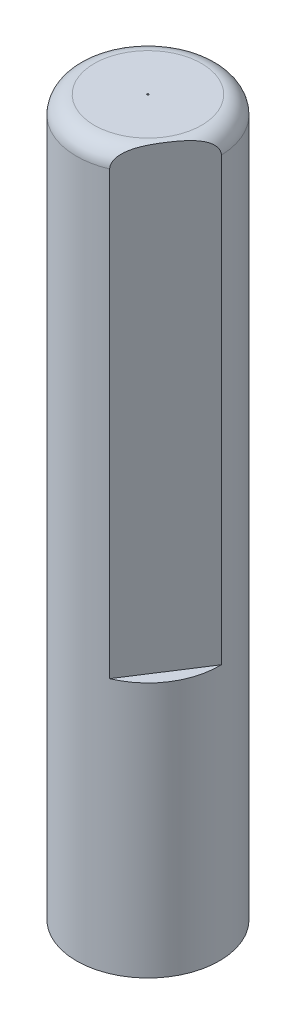
from build123d import *

# Parameters (mm, degrees)
SKETCH1_R           = 4
BOSS_EXTRUDE1_DEPTH = 40
FILLET1_R           = 1
CUT_EXTRUDE1_START  = -25.7
CUT_EXTRUDE1_DEPTH  = 25.7
SKETCH3_R           = 0.05
CUT_EXTRUDE2_DEPTH  = 0.1


with BuildPart() as part:
    # Sketch1 → Boss-Extrude1 (new body)
    with BuildSketch(Plane(origin=(0, 0, 0), x_dir=(1, 0, 0), z_dir=(0, 1, 0))):
        Circle(SKETCH1_R)
    extrude(amount=BOSS_EXTRUDE1_DEPTH)

    # Fillet1
    fillet1_edges = [part.edges().sort_by_distance(p)[0] for p in [
        (-4, 40, 0),
    ]]
    fillet(fillet1_edges, radius=FILLET1_R)

    # Sketch2 → Cut-Extrude1 (cut)
    with BuildSketch(Plane(origin=(0, 40, 0), x_dir=(1, 0, 0), z_dir=(0, 1, 0)).offset(CUT_EXTRUDE1_START)):
        with BuildLine():
            Line((1.546188852, -3.68907848), (3.998512047, 0.109093573))
            ThreePointArc((3.998512047, 0.109093573), (3.360424787, -2.169687823), (1.546188852, -3.68907848))
        make_face()
    extrude(amount=CUT_EXTRUDE1_DEPTH, mode=Mode.SUBTRACT)

    # Sketch3 → Cut-Extrude2 (cut)
    with BuildSketch(Plane(origin=(0, 40, 0), x_dir=(1, 0, 0), z_dir=(0, 1, 0))):
        Circle(SKETCH3_R)
    extrude(amount=-CUT_EXTRUDE2_DEPTH, mode=Mode.SUBTRACT)


solid = part.part
